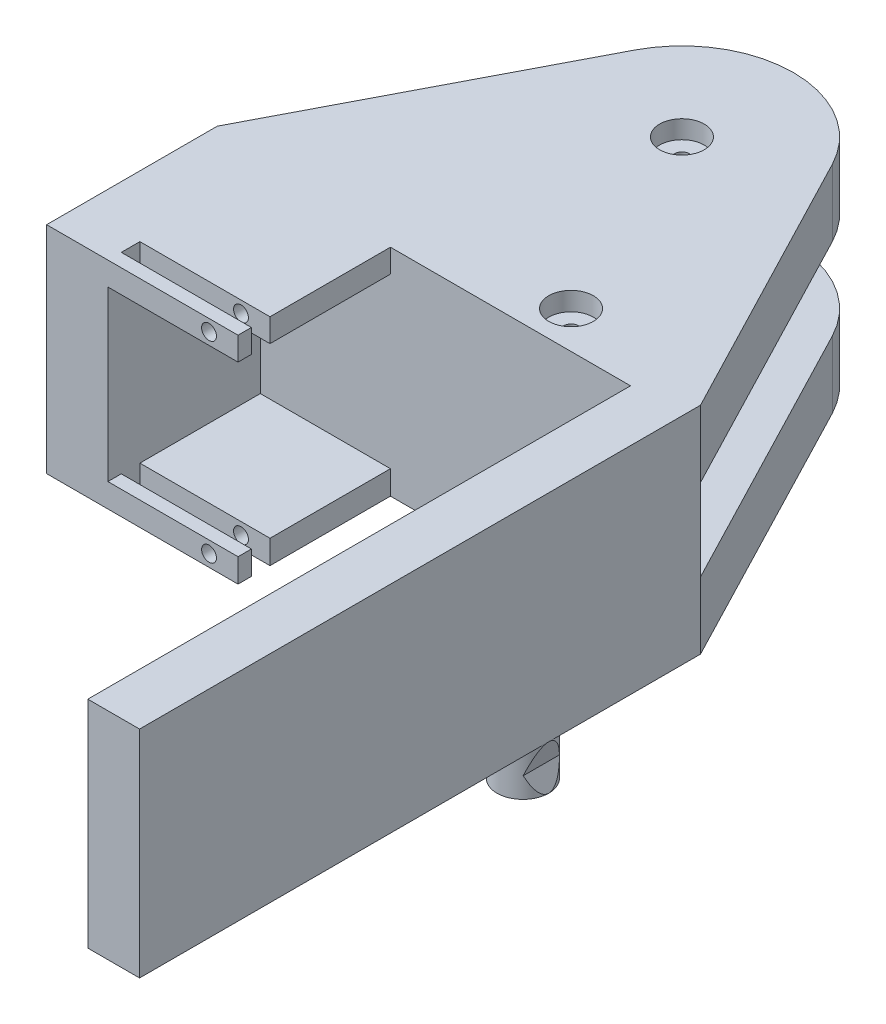
from build123d import *

# Parameters (mm, degrees)
SKETCH1_W             = 65
SKETCH1_H             = 9
BOSS_EXTRUDE1_DEPTH   = 45
BOSS_EXTRUDE1_2_DEPTH = 45
SKETCH2_R             = 1
CUT_EXTRUDE5_DEPTH    = 34
CUT_EXTRUDE6_DEPTH    = 34
SKETCH3_R             = 3
CUT_EXTRUDE7_DEPTH    = 2.45
SKETCH4_R             = 3
CUT_EXTRUDE8_DEPTH    = 2.45
SKETCH5_W             = 65
SKETCH5_H             = 29
BOSS_EXTRUDE2_DEPTH   = 2.45
SKETCH6_W             = 7
SKETCH6_H             = 6.853915881
SKETCH6_R             = 0.75
BOSS_EXTRUDE3_DEPTH   = 3.35
CUT_EXTRUDE9_DEPTH    = 3.35
BOSS_EXTRUDE4_DEPTH   = 2
SKETCH9_W             = 6.962412957
SKETCH9_H             = 29
BOSS_EXTRUDE5_DEPTH   = 73
SKETCH10_R            = 3
CUT_EXTRUDE10_DEPTH   = 2.5
CUT_EXTRUDE11_START   = -2.5
SKETCH11_R            = 3
CUT_EXTRUDE11_DEPTH   = 2.5
SKETCH12_R            = 1
CUT_EXTRUDE12_DEPTH   = 32.5
SKETCH13_W            = 25.743716973
SKETCH13_H            = 29
BOSS_EXTRUDE6_DEPTH   = 20.5
SKETCH14_W            = 16.2
SKETCH14_H            = 32.7
CUT_EXTRUDE13_DEPTH   = 17.5
SKETCH16_W            = 16.2
SKETCH16_H            = 3.197897976
SKETCH16_H_2          = 3.137509592
BOSS_EXTRUDE7_DEPTH   = 17.5
CUT_EXTRUDE14_DEPTH   = 17.5
SKETCH19_R            = 1
CUT_EXTRUDE15_DEPTH   = 10
SKETCH20_R            = 3.481206478
BOSS_EXTRUDE8_DEPTH   = 6
CUT_EXTRUDE17_DEPTH   = 66


with BuildPart() as part:
    # Sketch1 → Boss-Extrude1 (new body)
    with BuildSketch(Plane.XY):
        with Locations((32.5, 15.5)):
            Rectangle(SKETCH1_W, SKETCH1_H)
    extrude(amount=BOSS_EXTRUDE1_DEPTH)


with BuildPart() as body_2:
    # Sketch1 → Boss-Extrude1 2 (new body)
    with BuildSketch(Plane.XY):
        with Locations((32.5, 35.5)):
            Rectangle(SKETCH1_W, SKETCH1_H)
    extrude(amount=BOSS_EXTRUDE1_2_DEPTH)


with BuildPart() as cut_extrude5_tool:
    # Sketch2 → Cut-Extrude5 (new body)
    with BuildSketch(Plane.XZ.offset(-10)):
        with BuildLine():
            ThreePointArc((45.80925577, 8.081639583), (40.285389963, 2.178623197), (32.5, 0))
            Line((32.5, 0), (65, 0))
            Line((65, 0), (65, 45))
            Line((65, 45), (45.80925577, 8.081639583))
        make_face()
        with Locations((32.5, 15)):
            Circle(SKETCH2_R)
    extrude(amount=-CUT_EXTRUDE5_DEPTH)


with BuildPart() as part_1:
    add(part.part)

    # Cut-Extrude5: cut by cut_extrude5_tool
    add(cut_extrude5_tool.part, mode=Mode.SUBTRACT)


with BuildPart() as body_2_1:
    add(body_2.part)

    # Cut-Extrude5: cut by cut_extrude5_tool
    add(cut_extrude5_tool.part, mode=Mode.SUBTRACT)


with BuildPart() as cut_extrude6_tool:
    # Sketch2<6> → Cut-Extrude6 (new body)
    with BuildSketch(Plane.XZ.offset(-10)):
        with BuildLine():
            Line((19.19074423, 8.081639583), (0, 45))
            Line((0, 45), (0, 0))
            Line((0, 0), (32.5, 0))
            ThreePointArc((32.5, 0), (24.714610037, 2.178623197), (19.19074423, 8.081639583))
        make_face()
    extrude(amount=-CUT_EXTRUDE6_DEPTH)


with BuildPart() as part_2:
    add(part_1.part)

    # Cut-Extrude6: cut by cut_extrude6_tool
    add(cut_extrude6_tool.part, mode=Mode.SUBTRACT)

    # Sketch4 → Cut-Extrude8 (cut)
    with BuildSketch(Plane(origin=(0, 20, 0), x_dir=(1, 0, 0), z_dir=(0, 1, 0))):
        with Locations((32.5, -15)):
            Circle(SKETCH4_R)
    extrude(amount=-CUT_EXTRUDE8_DEPTH, mode=Mode.SUBTRACT)



with BuildPart() as body_2_2:
    add(body_2_1.part)

    # Cut-Extrude6: cut by cut_extrude6_tool
    add(cut_extrude6_tool.part, mode=Mode.SUBTRACT)

    # Sketch3 → Cut-Extrude7 (cut)
    with BuildSketch(Plane(origin=(0, 40, 0), x_dir=(1, 0, 0), z_dir=(0, 1, 0))):
        with Locations((32.5, -15)):
            Circle(SKETCH3_R)
    extrude(amount=-CUT_EXTRUDE7_DEPTH, mode=Mode.SUBTRACT)


with BuildPart() as part_3:
    add(part_2.part)

    add(body_2_2.part)  # Boss-Extrude2 merges body 2
    # Sketch5 → Boss-Extrude2 (add)
    with BuildSketch(Plane.XY.offset(45)):
        with Locations((32.5, 25.5)):
            Rectangle(SKETCH5_W, SKETCH5_H)
    extrude(amount=BOSS_EXTRUDE2_DEPTH)

    # Sketch6 → Boss-Extrude3 (add)
    with BuildSketch(Plane.XZ.offset(-11)):
        with Locations((32.5, 30.126957941)):
            Rectangle(SKETCH6_W, SKETCH6_H)
        with Locations((32.5, 28.3)):
            Circle(SKETCH6_R, mode=Mode.SUBTRACT)
    extrude(amount=BOSS_EXTRUDE3_DEPTH)

    # Sketch7 → Cut-Extrude9 (cut)
    with BuildSketch(Plane.XZ.offset(-7.65)):
        Polygon((29, 29.7), (29, 26.7), (31, 26.7), align=None)
        Polygon((34, 26.7), (36, 29.7), (36, 26.7), align=None)
    extrude(amount=-CUT_EXTRUDE9_DEPTH, mode=Mode.SUBTRACT)

    # Sketch8 → Boss-Extrude4 (add)
    with BuildSketch(Plane.XZ.offset(-7.65)):
        with BuildLine():
            ThreePointArc((30.454857608, 30.333257), (32.5, 32.242215881), (34.545142392, 30.333257))
            Line((34.545142392, 30.333257), (34.721110255, 27.781665383))
            Line((34.721110255, 27.781665383), (36, 29.7))
            Line((36, 29.7), (36, 33.553915881))
            Line((36, 33.553915881), (29, 33.553915881))
            Line((29, 33.553915881), (29, 29.7))
            Line((29, 29.7), (30.278889745, 27.781665383))
            Line((30.278889745, 27.781665383), (30.454857608, 30.333257))
        make_face()
    extrude(amount=BOSS_EXTRUDE4_DEPTH)

    # Sketch9 → Boss-Extrude5 (add)
    with BuildSketch(Plane.XY.offset(47.45)):
        with Locations((61.518793522, 25.5)):
            Rectangle(SKETCH9_W, SKETCH9_H)
    extrude(amount=BOSS_EXTRUDE5_DEPTH)

    # Sketch10 → Cut-Extrude10 (cut)
    with BuildSketch(Plane.XZ.offset(-11)):
        with Locations((45.037587043, 42.45)):
            Circle(SKETCH10_R)
    extrude(amount=-CUT_EXTRUDE10_DEPTH, mode=Mode.SUBTRACT)

    # Sketch11 → Cut-Extrude11 (cut)
    with BuildSketch(Plane(origin=(0, 40, 0), x_dir=(1, 0, 0), z_dir=(0, 1, 0)).offset(CUT_EXTRUDE11_START)):
        with Locations((45.037587043, -42.45)):
            Circle(SKETCH11_R)
    extrude(amount=CUT_EXTRUDE11_DEPTH, mode=Mode.SUBTRACT)

    # Sketch12 → Cut-Extrude12 (cut)
    with BuildSketch(Plane(origin=(0, 37.5, 0), x_dir=(1, 0, 0), z_dir=(0, 1, 0))):
        with Locations((45.037587043, -42.45)):
            Circle(SKETCH12_R)
    extrude(amount=-CUT_EXTRUDE12_DEPTH, mode=Mode.SUBTRACT)

    # Sketch13 → Boss-Extrude6 (add)
    with BuildSketch(Plane.XY.offset(47.45)):
        with Locations((12.871858487, 25.5)):
            Rectangle(SKETCH13_W, SKETCH13_H)
    extrude(amount=BOSS_EXTRUDE6_DEPTH)

    # Sketch14 → Cut-Extrude13 (cut)
    with BuildSketch(Plane(origin=(25.743716973, 0, 0), x_dir=(0, 0, -1), z_dir=(1, 0, 0))):
        with Locations((-55.55, 25.5)):
            Rectangle(SKETCH14_W, SKETCH14_H)
    extrude(amount=-CUT_EXTRUDE13_DEPTH, mode=Mode.SUBTRACT)

    # Sketch16 → Boss-Extrude7 (add)
    with BuildSketch(Plane(origin=(8.243716973, 0, 0), x_dir=(0, 0, -1), z_dir=(1, 0, 0))):
        with Locations((-55.55, 12.598948988)):
            Rectangle(SKETCH16_W, SKETCH16_H)
        with Locations((-55.55, 38.431245204)):
            Rectangle(SKETCH16_W, SKETCH16_H_2)
    extrude(amount=BOSS_EXTRUDE7_DEPTH)

    # Sketch17 → Cut-Extrude14 (cut)
    with BuildSketch(Plane(origin=(25.743716973, 0, 0), x_dir=(0, 0, -1), z_dir=(1, 0, 0))):
        Polygon((-66.15, 14.197897976), (-66.15, 11), (-63.65, 11), (-63.65, 40), (-66.15, 40), (-66.15, 36.862490408), (-67.95, 36.862490408), (-67.95, 14.197897976), align=None)
    extrude(amount=-CUT_EXTRUDE14_DEPTH, mode=Mode.SUBTRACT)

    # Sketch19 → Cut-Extrude15 (cut)
    with BuildSketch(Plane.XY.offset(67.95)):
        with Locations((21.843716973, 12.598948988)):
            Circle(SKETCH19_R)
        with Locations((21.843716973, 38.431245204)):
            Circle(SKETCH19_R)
    extrude(amount=-CUT_EXTRUDE15_DEPTH, mode=Mode.SUBTRACT)

    # Sketch20 → Boss-Extrude8 (add)
    with BuildSketch(Plane.XZ.offset(-11)):
        with Locations((61.518793522, 65.411058123)):
            Circle(SKETCH20_R)
    extrude(amount=BOSS_EXTRUDE8_DEPTH)

    # Sketch22 → Cut-Extrude17 (cut)
    with BuildSketch(Plane.XY.offset(120.45)):
        Polygon((65, 11), (64, 7.755866492), (65, 5), align=None)
    extrude(amount=-CUT_EXTRUDE17_DEPTH, mode=Mode.SUBTRACT)


solid = part_3.part
